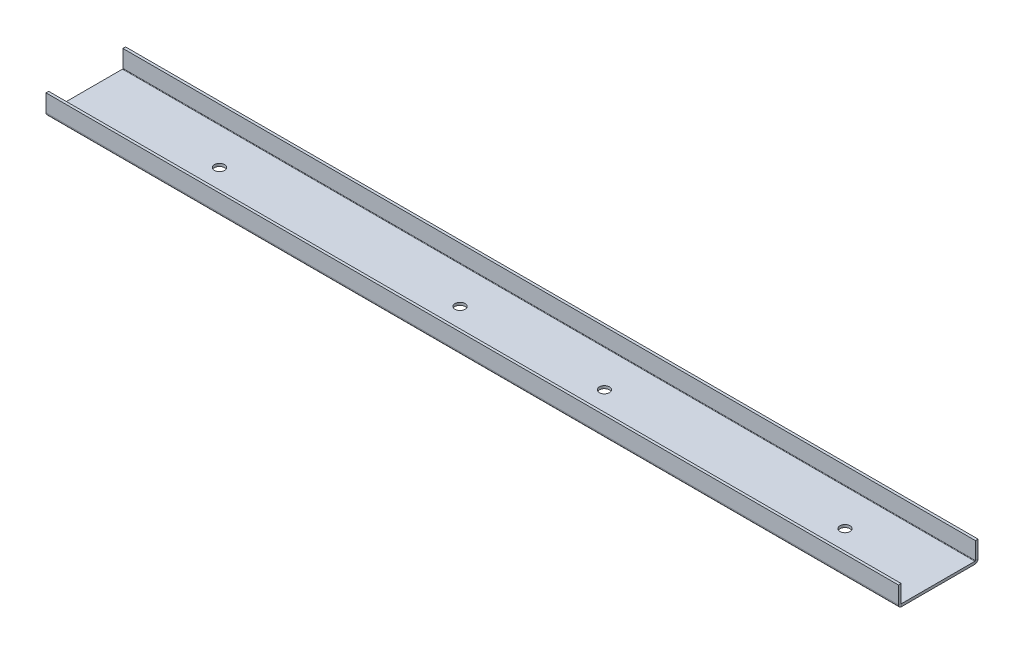
from build123d import *

# Parameters (mm, degrees)
BASE_FLANGE1_DEPTH = 450
SKETCH6_R          = 2.667
CUT_EXTRUDE1_DEPTH = 1.4


# Sheet-metal steps are written as plain solids
with BuildPart() as part:
    # Sketch1 → Base-Flange1 (new body)
    with BuildSketch(Plane(origin=(0, 0, 0), x_dir=(0, 0, -1), z_dir=(1, 0, 0))):
        with BuildLine():
            Line((0, 10.75), (0, 1.65))
            ThreePointArc((0, 1.65), (0.483273811, 0.483273811), (1.65, 0))
            Line((1.65, 0), (40.35, 0))
            ThreePointArc((40.35, 0), (41.516726189, 0.483273811), (42, 1.65))
            Line((42, 1.65), (42, 10.75))
            Line((42, 10.75), (40.6, 10.75))
            Line((40.6, 10.75), (40.6, 1.65))
            ThreePointArc((40.6, 1.65), (40.526776695, 1.473223305), (40.35, 1.4))
            Line((40.35, 1.4), (1.65, 1.4))
            ThreePointArc((1.65, 1.4), (1.473223305, 1.473223305), (1.4, 1.65))
            Line((1.4, 1.65), (1.4, 10.75))
            Line((1.4, 10.75), (0, 10.75))
        make_face()
    extrude(amount=BASE_FLANGE1_DEPTH)

    # Sketch6 → Cut-Extrude1 (cut)
    with BuildSketch(Plane.XZ):
        with Locations(Location((400.7875, -21, 0), (0, 0, 270))):
            Circle(SKETCH6_R)
        with Locations(Location((273.7875, -21, 0), (0, 0, 270))):
            Circle(SKETCH6_R)
        with Locations(Location((197.5875, -21, 0), (0, 0, 270))):
            Circle(SKETCH6_R)
        with Locations(Location((70.5875, -21, 0), (0, 0, 270))):
            Circle(SKETCH6_R)
    extrude(amount=-CUT_EXTRUDE1_DEPTH, mode=Mode.SUBTRACT)


solid = part.part
